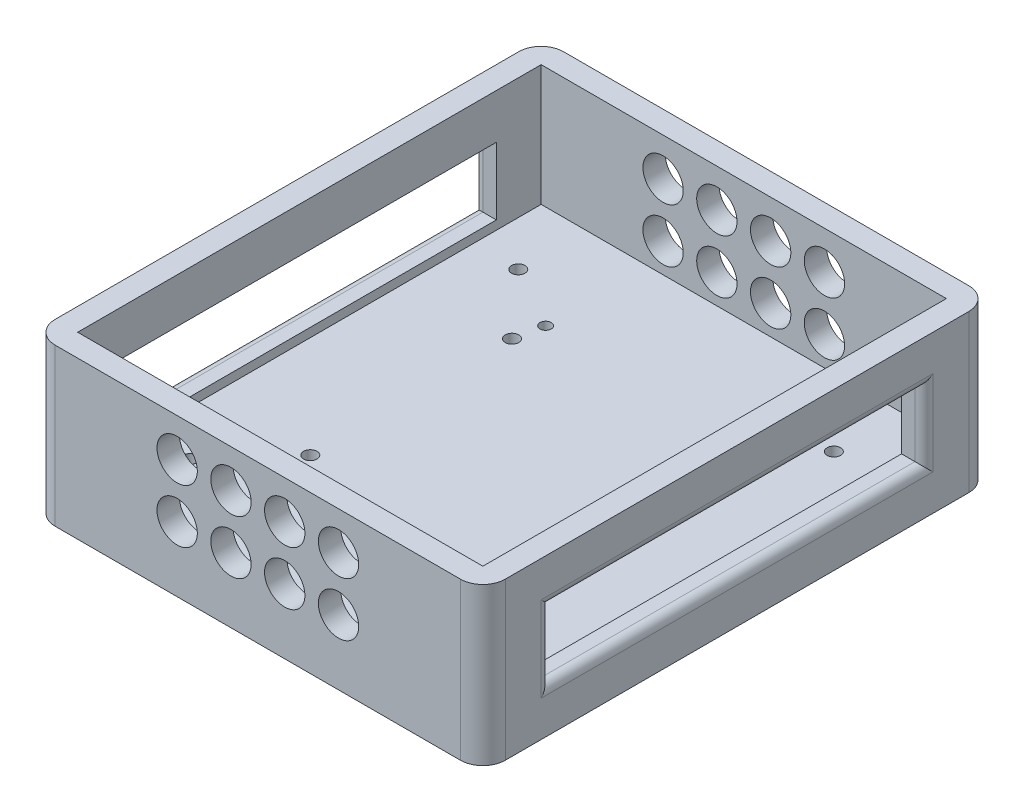
from build123d import *

# Parameters (mm, degrees)
SKETCH1_W            = 100.4
SKETCH1_H            = 113.4
BOSS_EXTRUDE2_DEPTH  = 35
SKETCH2_W            = 90.4
SKETCH2_H            = 103.4
CUT_EXTRUDE1_DEPTH   = 27
FILLET4_R            = 5
SKETCH4_W            = 83.4
SKETCH4_H            = 15
CUT_EXTRUDE3_DEPTH   = 123
FILLET5_R            = 2
FILLET6_R            = 2
SKETCH3_R            = 4.5
CUT_EXTRUDE4_DEPTH   = 123
SKETCH5_R            = 1.5
CUT_EXTRUDE5_DEPTH   = 37
SKETCH6_R            = 3
CUT_EXTRUDE6_DEPTH   = 4
SKETCH7_R            = 1.25
CUT_EXTRUDE7_DEPTH   = 17
SKETCH8_R            = 1.5
CUT_EXTRUDE8_DEPTH   = 9
SKETCH9_R            = 3
CUT_EXTRUDE9_DEPTH   = 4
LPATTERN2_COUNT      = 4
LPATTERN2_PITCH      = 12
LPATTERN2_COUNT_DIR2 = 2
LPATTERN2_PITCH_DIR2 = 12


with BuildPart() as part:
    # Sketch1 → Boss-Extrude2 (new body)
    with BuildSketch(Plane(origin=(0, 0, 0), x_dir=(1, 0, 0), z_dir=(0, 1, 0))):
        Rectangle(SKETCH1_W, SKETCH1_H)
    extrude(amount=BOSS_EXTRUDE2_DEPTH)

    # Sketch2 → Cut-Extrude1 (cut)
    with BuildSketch(Plane(origin=(0, 35, 0), x_dir=(1, 0, 0), z_dir=(0, 1, 0))):
        Rectangle(SKETCH2_W, SKETCH2_H)
    extrude(amount=-CUT_EXTRUDE1_DEPTH, mode=Mode.SUBTRACT)

    # Fillet4
    fillet4_edges = [part.edges().sort_by_distance(p)[0] for p in [
        (50.2, 17.5, -56.7),
        (-50.2, 17.5, -56.7),
        (-50.2, 17.5, 56.7),
        (50.2, 17.5, 56.7),
    ]]
    fillet(fillet4_edges, radius=FILLET4_R)

    # Sketch4 → Cut-Extrude3 (cut)
    with BuildSketch(Plane(origin=(50.2, 0, 0), x_dir=(0, 0, -1), z_dir=(1, 0, 0))):
        with Locations((0, 17.5)):
            Rectangle(SKETCH4_W, SKETCH4_H)
    extrude(amount=-CUT_EXTRUDE3_DEPTH, mode=Mode.SUBTRACT)

    # Fillet5
    fillet5_edges = [part.edges().sort_by_distance(p)[0] for p in [
        (50.2, 17.5, 41.7),
        (50.2, 25, 0),
        (50.2, 17.5, -41.7),
        (50.2, 10, 0),
    ]]
    fillet(fillet5_edges, radius=FILLET5_R)

    # Fillet6
    fillet6_edges = [part.edges().sort_by_distance(p)[0] for p in [
        (-50.2, 17.5, 41.7),
        (-50.2, 25, 0),
        (-50.2, 17.5, -41.7),
        (-50.2, 10, 0),
    ]]
    fillet(fillet6_edges, radius=FILLET6_R)

    # Sketch3 → Cut-Extrude4 (cut)
    with BuildSketch(Plane(origin=(0, 0, -56.7), x_dir=(-1, 0, 0), z_dir=(0, 0, -1))):
        with Locations((-18, 14.5)):
            Circle(SKETCH3_R)
    cut_extrude4 = extrude(amount=-CUT_EXTRUDE4_DEPTH, mode=Mode.SUBTRACT)

    # Sketch5 → Cut-Extrude5 (cut)
    with BuildSketch(Plane(origin=(0, 8, 0), x_dir=(1, 0, 0), z_dir=(0, 1, 0))):
        with Locations((-22.5, 22.5)):
            Circle(SKETCH5_R)
        with Locations((22.5, 22.5)):
            Circle(SKETCH5_R)
        with Locations((-22.5, -22.5)):
            Circle(SKETCH5_R)
        with Locations((22.5, -22.5)):
            Circle(SKETCH5_R)
    extrude(amount=-CUT_EXTRUDE5_DEPTH, mode=Mode.SUBTRACT)

    # Sketch6 → Cut-Extrude6 (cut)
    with BuildSketch(Plane.XZ):
        with Locations((-22.5, 22.5)):
            Circle(SKETCH6_R)
        with Locations((-22.5, -22.5)):
            Circle(SKETCH6_R)
        with Locations((22.5, 22.5)):
            Circle(SKETCH6_R)
        with Locations((22.5, -22.5)):
            Circle(SKETCH6_R)
    extrude(amount=-CUT_EXTRUDE6_DEPTH, mode=Mode.SUBTRACT)

    # Sketch7 → Cut-Extrude7 (cut)
    with BuildSketch(Plane.XZ):
        with Locations((-21.25, 28.75)):
            Circle(SKETCH7_R)
        with Locations((-21.25, -28.75)):
            Circle(SKETCH7_R)
        with Locations((21.25, -28.75)):
            Circle(SKETCH7_R)
        with Locations((21.25, 28.75)):
            Circle(SKETCH7_R)
    extrude(amount=-CUT_EXTRUDE7_DEPTH, mode=Mode.SUBTRACT)

    # Sketch8 → Cut-Extrude8 (cut)
    with BuildSketch(Plane(origin=(0, 8, 0), x_dir=(1, 0, 0), z_dir=(0, 1, 0))):
        with Locations((-35.2, 36.6)):
            Circle(SKETCH8_R)
        with Locations((35.2, 36.6)):
            Circle(SKETCH8_R)
        with Locations((-35.2, -36.7)):
            Circle(SKETCH8_R)
        with Locations((35.2, -36.7)):
            Circle(SKETCH8_R)
    extrude(amount=-CUT_EXTRUDE8_DEPTH, mode=Mode.SUBTRACT)

    # Sketch9 → Cut-Extrude9 (cut)
    with BuildSketch(Plane.XZ):
        with Locations((-35.2, 36.7)):
            Circle(SKETCH9_R)
        with Locations((35.2, 36.7)):
            Circle(SKETCH9_R)
        with Locations((-35.2, -36.6)):
            Circle(SKETCH9_R)
        with Locations((35.2, -36.6)):
            Circle(SKETCH9_R)
    extrude(amount=-CUT_EXTRUDE9_DEPTH, mode=Mode.SUBTRACT)

    # LPattern2: Cut-Extrude4 4 × 2
    with Locations(*[(-i * LPATTERN2_PITCH, j * LPATTERN2_PITCH_DIR2, 0) for i in range(LPATTERN2_COUNT) for j in range(LPATTERN2_COUNT_DIR2) if (i, j) != (0, 0)]):
        add(cut_extrude4, mode=Mode.SUBTRACT)


solid = part.part
